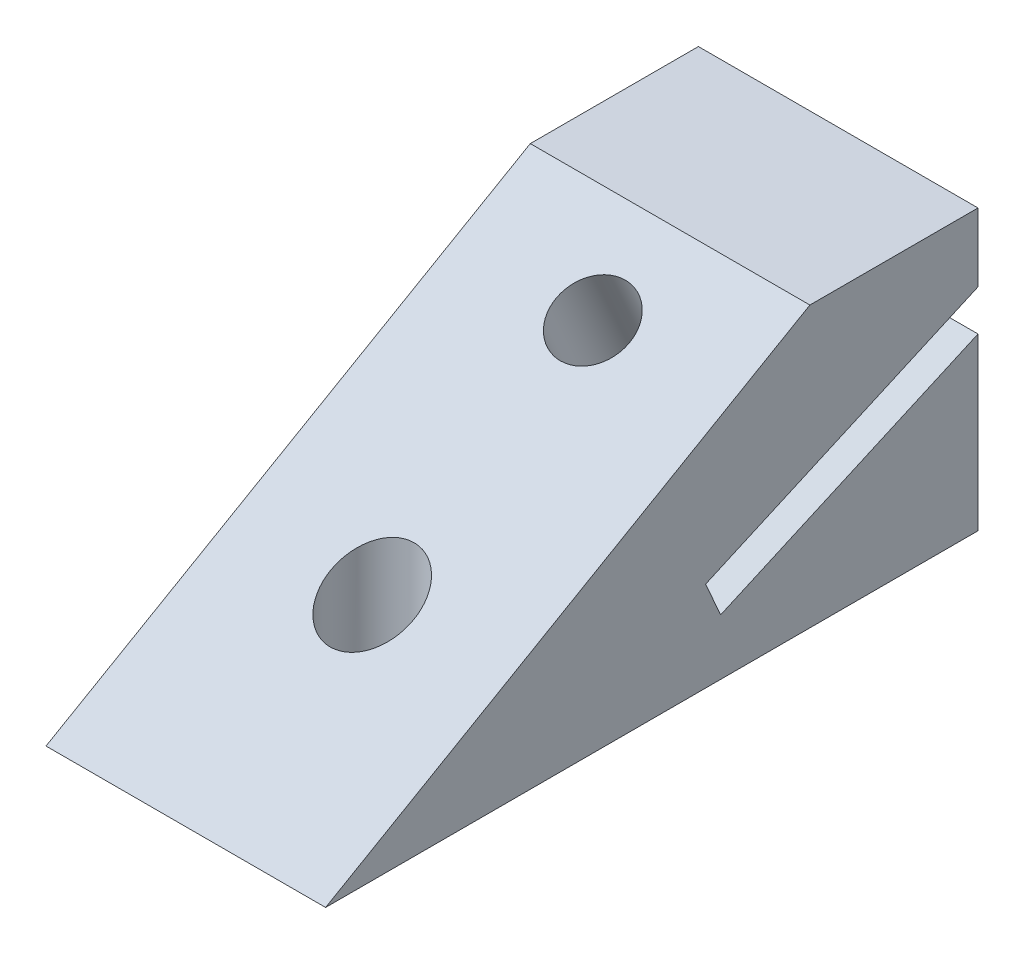
from build123d import *

# Parameters (mm, degrees)
BOSS_EXTRUDE2_DEPTH     = 15
CUT_EXTRUDE5_DEPTH      = 11
CUT_EXTRUDE5_DEPTH_BACK = 2
SKETCH7_R               = 2
M4_CLEARANCE_HOLE2_D    = 4.5


with BuildPart() as part:
    # Sketch3 → Boss-Extrude2 (new body)
    with BuildSketch(Plane(origin=(0, 0, 0), x_dir=(0, 0, -1), z_dir=(1, 0, 0))):
        Polygon((25.980762114, 15), (0, 0), (35, 0), (35, 9.145604647), (21.196745964, 3), (20.383272678, 4.827090915), (35, 11.334877204), (35, 15), align=None)
    extrude(amount=BOSS_EXTRUDE2_DEPTH)

    # Sketch7 → Cut-Extrude5 (cut, two sides: drawn at the far end of the back side and taken through both)
    with BuildSketch(Plane(origin=(0, -5.37243013, -2.391960004), x_dir=(1, 0, 0), z_dir=(0, 0.9135454576426009, 0.4067366430758006)).offset(-CUT_EXTRUDE5_DEPTH_BACK)):
        with Locations((7.5, 25.075140664)):
            Circle(SKETCH7_R)
    extrude(amount=CUT_EXTRUDE5_DEPTH + CUT_EXTRUDE5_DEPTH_BACK, mode=Mode.SUBTRACT)

    # M4 Clearance Hole2 (through all)
    with Locations(Plane(origin=(-36.5, 0, -130), x_dir=(0, 0, -1), z_dir=(0, -1, 0))):
        with Locations((-120, 44), (-85, -33.75), (-85, -16), (-85, 1.75), (-120, 1.75), (-120, -16), (-120, -33.75), (41.808529327, -45.202963534), (68.808529327, -45.202963534), (68.808529327, -0.783608695), (41.808529327, -0.783608695)):
            Hole(M4_CLEARANCE_HOLE2_D / 2)


solid = part.part
